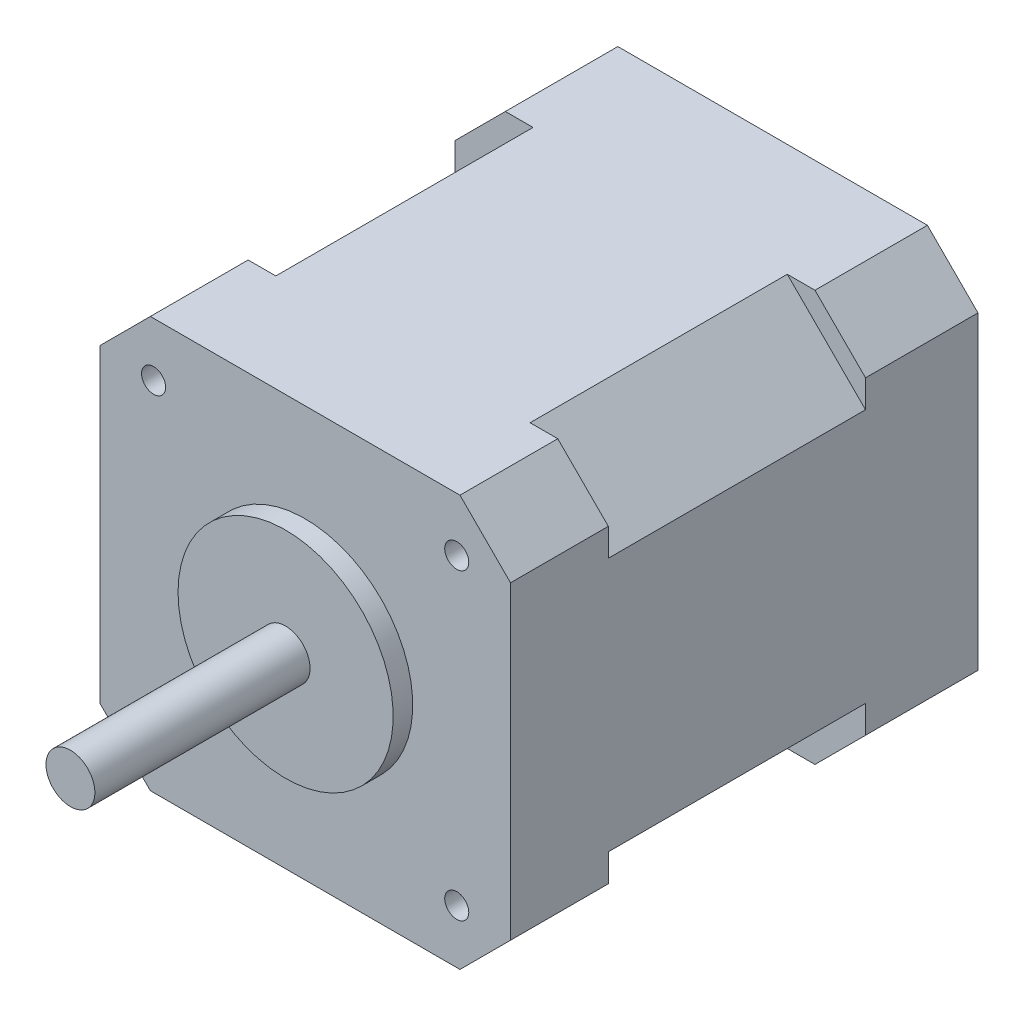
from build123d import *

# Parameters (mm, degrees)
BOSS_EXTRUDE1_DEPTH = 11.5
BOSS_EXTRUDE2_DEPTH = 26.3
BOSS_EXTRUDE3_DEPTH = 10
SKETCH4_W           = 10
SKETCH4_H           = 0.6
SKETCH5_W           = 10
SKETCH5_H           = 0.6
SKETCH6_W           = 10
SKETCH6_H           = 0.6
SKETCH7_W           = 10
SKETCH7_H           = 0.6
HOLE1_D             = 2.459
HOLE1_DEPTH         = 5
HOLE2_D             = 2.459
HOLE2_DEPTH         = 5
HOLE3_D             = 2.459
HOLE3_DEPTH         = 5
HOLE4_D             = 2.459
HOLE4_DEPTH         = 5


with BuildPart() as part:
    # Sketch1 → Boss-Extrude1 (new body)
    with BuildSketch(Plane(origin=(0, 0, 0), x_dir=(-1, 0, 0), z_dir=(0, 0, -1))):
        Polygon((-15.828427125, 21), (-21, 15.828427125), (-21, -15.828427125), (-15.828427125, -21), (15.828427125, -21), (21, -15.828427125), (21, 15.828427125), (15.828427125, 21), align=None)
    extrude(amount=-BOSS_EXTRUDE1_DEPTH)

    # Sketch2 → Boss-Extrude2 (add)
    with BuildSketch(Plane.XY.offset(11.5)):
        Polygon((13, -21), (-13, -21), (-21, -13), (-21, 13), (-13, 21), (13, 21), (21, 13), (21, -13), align=None)
    extrude(amount=BOSS_EXTRUDE2_DEPTH)

    # Sketch3 → Boss-Extrude3 (add)
    with BuildSketch(Plane.XY.offset(37.8)):
        Polygon((15.828427125, 21), (21, 15.828427125), (21, -15.828427125), (15.828427125, -21), (-15.828427125, -21), (-21, -15.828427125), (-21, 15.828427125), (-15.828427125, 21), align=None)
    extrude(amount=BOSS_EXTRUDE3_DEPTH)

    # Sketch4 → Revolve1 (revolve)
    with BuildSketch(Plane.XY.offset(3.65)):
        with Locations((-26, 0.95)):
            Rectangle(SKETCH4_W, SKETCH4_H)
    revolve(axis=Axis((-31, 0.65, 3.65), (1, 0, 0)))

    # Sketch5 → Revolve2 (revolve)
    with BuildSketch(Plane.XY.offset(3.65)):
        with Locations((-26, -0.35)):
            Rectangle(SKETCH5_W, SKETCH5_H)
    revolve(axis=Axis((-31, -0.65, 3.65), (1, 0, 0)))

    # Sketch6 → Revolve3 (revolve)
    with BuildSketch(Plane.XY.offset(4.95)):
        with Locations((-26, -0.35)):
            Rectangle(SKETCH6_W, SKETCH6_H)
    revolve(axis=Axis((-31, -0.65, 4.95), (1, 0, 0)))

    # Sketch7 → Revolve4 (revolve)
    with BuildSketch(Plane.XY.offset(4.95)):
        with Locations((-26, 0.95)):
            Rectangle(SKETCH7_W, SKETCH7_H)
    revolve(axis=Axis((-31, 0.65, 4.95), (1, 0, 0)))

    # Sketch8 → Revolve5 (revolve)
    with BuildSketch(Plane.XZ):
        Polygon((2.5, 71.8), (0, 71.8), (0, 47.8), (11, 47.8), (11, 49.8), (2.5, 49.8), align=None)
    revolve(axis=Axis((0, 0, 71.8), (0, 0, -1)))

    # Hole1
    with Locations(Plane.XY.offset(47.8)):
        with Locations((-15.5, 15.5)):
            Hole(HOLE1_D / 2, depth=HOLE1_DEPTH)

    # Hole2
    with Locations(Plane.XY.offset(47.8)):
        with Locations((-15.5, -15.5)):
            Hole(HOLE2_D / 2, depth=HOLE2_DEPTH)

    # Hole3
    with Locations(Plane.XY.offset(47.8)):
        with Locations((15.5, 15.5)):
            Hole(HOLE3_D / 2, depth=HOLE3_DEPTH)

    # Hole4
    with Locations(Plane.XY.offset(47.8)):
        with Locations((15.5, -15.5)):
            Hole(HOLE4_D / 2, depth=HOLE4_DEPTH)


solid = part.part
